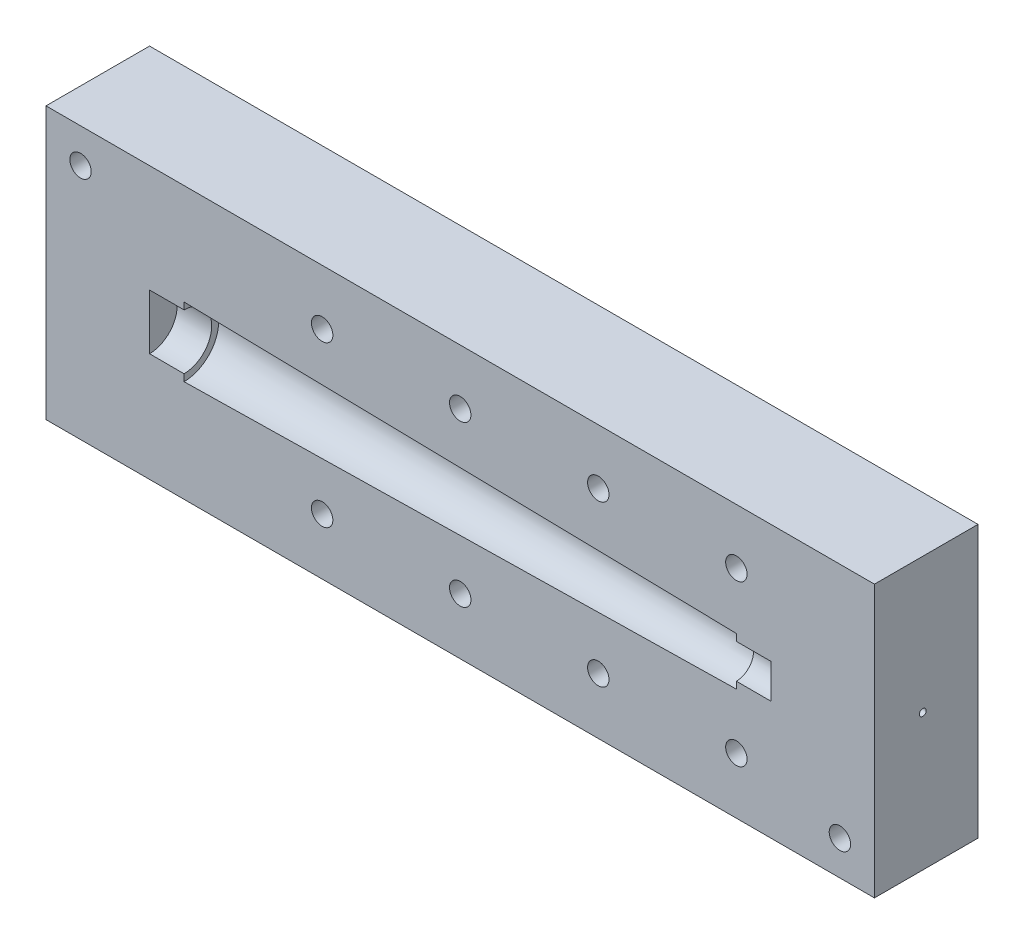
from build123d import *

# Parameters (mm, degrees)
SKIZZE2_W                        = 120
SKIZZE2_H                        = 39.364160046
AUFSATZ_LINEAR_AUSTRAGEN1_DEPTH  = 30
SKIZZE24_R                       = 1.55
SCHNITT_LINEAR_AUSTRAGEN4_DEPTH  = 130.805766806
SKIZZE46_R                       = 2.85
SCHNITT_LINEAR_AUSTRAGEN15_DEPTH = 10
SCHNITT_LINEAR_START             = -5
SCHNITT_LINEAR_AUSTRAGEN25_DEPTH = 2.7
LINEARES_MUSTER1_COUNT           = 4
LINEARES_MUSTER1_PITCH           = 20
SPIEGELN2_COPY_1_SKETCH_R        = 2.85
SPIEGELN2_COPY_1_DEPTH           = 10
SPIEGELN2_COPY_2_SKETCH_R        = 2.85
SPIEGELN2_COPY_2_DEPTH           = 10
SPIEGELN2_COPY_3_SKETCH_R        = 2.85
SPIEGELN2_COPY_3_DEPTH           = 10
SPIEGELN2_START                  = -5
SPIEGELN2_COPY_4_DEPTH           = 2.7
SPIEGELN2_COPY_5_DEPTH           = 2.7
SPIEGELN2_COPY_6_DEPTH           = 2.7
SKIZZE51_R                       = 1.55
SCHNITT_LINEAR_AUSTRAGEN26_DEPTH = 130.805766806
SKIZZE75_R                       = 0.75
SCHNITT_LINEAR_AUSTRAGEN28_DEPTH = 10
SKIZZE76_R                       = 2
SCHNITT_LINEAR_AUSTRAGEN29_DEPTH = 6
SKIZZE80_R                       = 0.5
SCHNITT_LINEAR_AUSTRAGEN34_DEPTH = 21
SCHNITT_LINEAR_START_2           = -7.5
SKIZZE81_R                       = 0.5
SCHNITT_LINEAR_AUSTRAGEN36_DEPTH = 5
ABSPALTEN3_START                 = 15
ABSPALTEN3_OUTLINE_W             = 120
ABSPALTEN3_OUTLINE_H             = 39.364160046
ABSPALTEN3_OUTLINE_R             = 1.55
ABSPALTEN3_DEPTH                 = 15


# Read off the part's stored shape, not the designer's step: Abspalten3
with BuildPart() as part:
    # Skizze2 → Aufsatz-Linear austragen1 (new body)
    with BuildSketch(Plane.XY):
        with Locations((60, 19.682080023)):
            Rectangle(SKIZZE2_W, SKIZZE2_H)
    extrude(amount=AUFSATZ_LINEAR_AUSTRAGEN1_DEPTH)

    # Skizze24 → Schnitt-Linear austragen4 (cut, through all)
    with BuildSketch(Plane.XY.offset(30)):
        with Locations((40, 31.364160046)):
            Circle(SKIZZE24_R)
        with Locations((60, 31.364160046)):
            Circle(SKIZZE24_R)
        with Locations((80, 31.364160046)):
            Circle(SKIZZE24_R)
        with Locations((100, 31.364160046)):
            Circle(SKIZZE24_R)
    schnitt_linear_austragen4 = extrude(amount=-SCHNITT_LINEAR_AUSTRAGEN4_DEPTH, mode=Mode.SUBTRACT)

    # Skizze46 → Schnitt-Linear austragen15 (cut)
    with BuildSketch(Plane(origin=(0, 0, 0), x_dir=(-1, 0, 0), z_dir=(0, 0, -1))):
        with Locations((-100, 31.364160046)):
            Circle(SKIZZE46_R)
    schnitt_linear_austragen15 = extrude(amount=-SCHNITT_LINEAR_AUSTRAGEN15_DEPTH, mode=Mode.SUBTRACT)

    # Skizze50 → Schnitt-Linear austragen25 (cut)
    with BuildSketch(Plane.XY.offset(30).offset(SCHNITT_LINEAR_START)):
        Polygon((97.15, 33.009608314), (97.15, 39.364160046), (102.85, 39.364160046), (102.85, 33.009608314), (102.85, 29.718711779), (100, 28.073263512), (97.15, 29.718711779), align=None)
    schnitt_linear_austragen25 = extrude(amount=-SCHNITT_LINEAR_AUSTRAGEN25_DEPTH, mode=Mode.SUBTRACT)

    # Lineares Muster1: Schnitt-Linear austragen15, Schnitt-Linear austragen25 ×4
    with Locations(*[(-i * LINEARES_MUSTER1_PITCH, 0, 0) for i in range(1, LINEARES_MUSTER1_COUNT)]):
        add(schnitt_linear_austragen15, mode=Mode.SUBTRACT)
        add(schnitt_linear_austragen25, mode=Mode.SUBTRACT)

    # Spiegeln2: Schnitt-Linear austragen15, Schnitt-Linear austragen25 across plane
    add(schnitt_linear_austragen15.mirror(Plane.ZX.offset(19.764160046)), mode=Mode.SUBTRACT)
    add(schnitt_linear_austragen25.mirror(Plane.ZX.offset(19.764160046)), mode=Mode.SUBTRACT)

    # Spiegeln2 copy 1 sketch → Spiegeln2 copy 1 (cut)
    with BuildSketch(Plane(origin=(-20, 39.528320093, 0), x_dir=(-1, 0, 0), z_dir=(0, 0, -1))):
        with Locations((-100, -31.364160046)):
            Circle(SPIEGELN2_COPY_1_SKETCH_R)
    extrude(amount=-SPIEGELN2_COPY_1_DEPTH, mode=Mode.SUBTRACT)

    # Spiegeln2 copy 2 sketch → Spiegeln2 copy 2 (cut)
    with BuildSketch(Plane(origin=(-40, 39.528320093, 0), x_dir=(-1, 0, 0), z_dir=(0, 0, -1))):
        with Locations((-100, -31.364160046)):
            Circle(SPIEGELN2_COPY_2_SKETCH_R)
    extrude(amount=-SPIEGELN2_COPY_2_DEPTH, mode=Mode.SUBTRACT)

    # Spiegeln2 copy 3 sketch → Spiegeln2 copy 3 (cut)
    with BuildSketch(Plane(origin=(-60, 39.528320093, 0), x_dir=(-1, 0, 0), z_dir=(0, 0, -1))):
        with Locations((-100, -31.364160046)):
            Circle(SPIEGELN2_COPY_3_SKETCH_R)
    extrude(amount=-SPIEGELN2_COPY_3_DEPTH, mode=Mode.SUBTRACT)

    # Spiegeln2 copy 4 sketch → Spiegeln2 copy 4 (cut)
    with BuildSketch(Plane(origin=(-20, 39.528320093, 30), x_dir=(1, 0, 0), z_dir=(0, 0, 1)).offset(SPIEGELN2_START)):
        Polygon((97.15, -33.009608314), (97.15, -39.364160046), (102.85, -39.364160046), (102.85, -33.009608314), (102.85, -29.718711779), (100, -28.073263512), (97.15, -29.718711779), align=None)
    extrude(amount=-SPIEGELN2_COPY_4_DEPTH, mode=Mode.SUBTRACT)

    # Spiegeln2 copy 5 sketch → Spiegeln2 copy 5 (cut)
    with BuildSketch(Plane(origin=(-40, 39.528320093, 30), x_dir=(1, 0, 0), z_dir=(0, 0, 1)).offset(SPIEGELN2_START)):
        Polygon((97.15, -33.009608314), (97.15, -39.364160046), (102.85, -39.364160046), (102.85, -33.009608314), (102.85, -29.718711779), (100, -28.073263512), (97.15, -29.718711779), align=None)
    extrude(amount=-SPIEGELN2_COPY_5_DEPTH, mode=Mode.SUBTRACT)

    # Spiegeln2 copy 6 sketch → Spiegeln2 copy 6 (cut)
    with BuildSketch(Plane(origin=(-60, 39.528320093, 30), x_dir=(1, 0, 0), z_dir=(0, 0, 1)).offset(SPIEGELN2_START)):
        Polygon((97.15, -33.009608314), (97.15, -39.364160046), (102.85, -39.364160046), (102.85, -33.009608314), (102.85, -29.718711779), (100, -28.073263512), (97.15, -29.718711779), align=None)
    extrude(amount=-SPIEGELN2_COPY_6_DEPTH, mode=Mode.SUBTRACT)

    # Spiegeln3: Schnitt-Linear austragen4 across plane
    add(schnitt_linear_austragen4.mirror(Plane.ZX.offset(19.764160046)), mode=Mode.SUBTRACT)

    # Skizze51 → Schnitt-Linear austragen26 (cut, through all)
    with BuildSketch(Plane.XY.offset(30)):
        with Locations((5, 34.364160046)):
            Circle(SKIZZE51_R)
        with Locations((115, 5)):
            Circle(SKIZZE51_R)
    extrude(amount=-SCHNITT_LINEAR_AUSTRAGEN26_DEPTH, mode=Mode.SUBTRACT)

    # Skizze73 → Schnitt-Rotation5 (revolve, cut)
    with BuildSketch(Plane.XY.offset(15)):
        Polygon((15, 19.764160046), (15, 23.764160046), (20, 23.764160046), (20, 24.764160046), (100, 23.182080023), (100, 22.182080023), (105, 22.182080023), (105, 19.682080023), align=None)
    revolve(axis=Axis((105, 19.682080023, 15), (-0.9999995841280241, 0.0009119998787298228, 0)), mode=Mode.SUBTRACT)

    # Skizze75 → Schnitt-Linear austragen28 (cut)
    with BuildSketch(Plane.XY.offset(30)):
        with Locations((21.598259807, 19.682080023)):
            Circle(SKIZZE75_R)
    extrude(amount=-SCHNITT_LINEAR_AUSTRAGEN28_DEPTH, mode=Mode.SUBTRACT)

    # Skizze76 → Schnitt-Linear austragen29 (cut)
    with BuildSketch(Plane.XY.offset(30)):
        with Locations((21.598259807, 19.682080023)):
            Circle(SKIZZE76_R)
    extrude(amount=-SCHNITT_LINEAR_AUSTRAGEN29_DEPTH, mode=Mode.SUBTRACT)

    # Skizze80 → Schnitt-Linear austragen34 (cut)
    with BuildSketch(Plane(origin=(120, 0, 0), x_dir=(0, 0, -1), z_dir=(1, 0, 0))):
        with Locations((-22.000416524, 19.763714623)):
            Circle(SKIZZE80_R)
    schnitt_linear_austragen34 = extrude(amount=-SCHNITT_LINEAR_AUSTRAGEN34_DEPTH, mode=Mode.SUBTRACT)

    # Skizze81 → Schnitt-Linear austragen36 (cut)
    with BuildSketch(Plane.XY.offset(30).offset(SCHNITT_LINEAR_START_2)):
        with Locations(Location((99, 19.682080023, 0), (0, 0, 7.034090001))):
            Circle(SKIZZE81_R)
    schnitt_linear_austragen36 = extrude(amount=-SCHNITT_LINEAR_AUSTRAGEN36_DEPTH, mode=Mode.SUBTRACT)

    # Spiegeln4: Schnitt-Linear austragen34, Schnitt-Linear austragen36 across plane
    add(schnitt_linear_austragen34.mirror(Plane.XY.offset(15)), mode=Mode.SUBTRACT)
    add(schnitt_linear_austragen36.mirror(Plane.XY.offset(15)), mode=Mode.SUBTRACT)

    # Abspalten3 outline → Abspalten3 (cut)
    with BuildSketch(Plane.XY.offset(ABSPALTEN3_START)):
        with Locations((60, 19.682080023)):
            Rectangle(ABSPALTEN3_OUTLINE_W, ABSPALTEN3_OUTLINE_H)
        with Locations((115, 5)):
            Circle(ABSPALTEN3_OUTLINE_R, mode=Mode.SUBTRACT)
        with Locations((5, 34.364160046)):
            Circle(ABSPALTEN3_OUTLINE_R, mode=Mode.SUBTRACT)
        with Locations((40, 31.364160046)):
            Circle(ABSPALTEN3_OUTLINE_R, mode=Mode.SUBTRACT)
        with Locations((60, 31.364160046)):
            Circle(ABSPALTEN3_OUTLINE_R, mode=Mode.SUBTRACT)
        with Locations((80, 31.364160046)):
            Circle(ABSPALTEN3_OUTLINE_R, mode=Mode.SUBTRACT)
        with Locations((100, 31.364160046)):
            Circle(ABSPALTEN3_OUTLINE_R, mode=Mode.SUBTRACT)
        with Locations((40, 8.164160046)):
            Circle(ABSPALTEN3_OUTLINE_R, mode=Mode.SUBTRACT)
        with Locations((60, 8.164160046)):
            Circle(ABSPALTEN3_OUTLINE_R, mode=Mode.SUBTRACT)
        with Locations((80, 8.164160046)):
            Circle(ABSPALTEN3_OUTLINE_R, mode=Mode.SUBTRACT)
        with Locations((100, 8.164160046)):
            Circle(ABSPALTEN3_OUTLINE_R, mode=Mode.SUBTRACT)
    extrude(amount=ABSPALTEN3_DEPTH, mode=Mode.SUBTRACT)


solid = part.part
